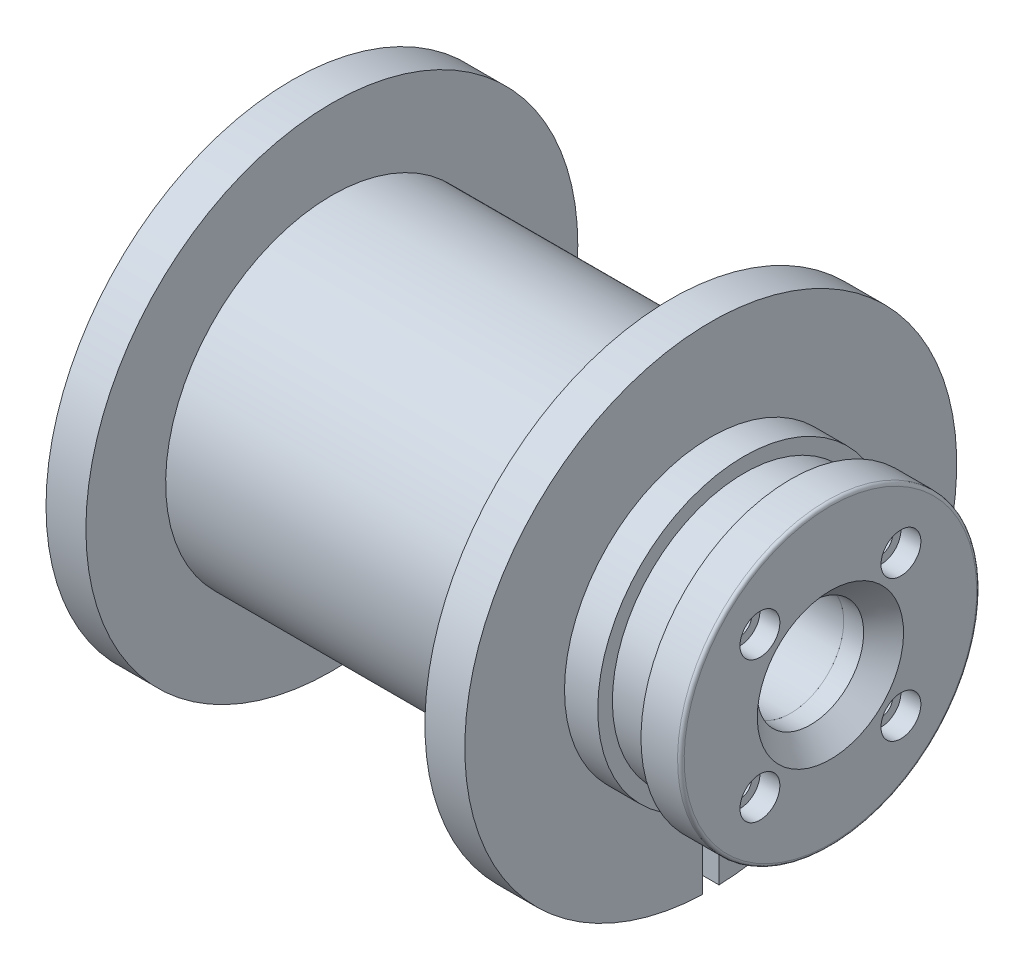
from build123d import *

# Parameters (mm, degrees)
SKETCH_5_W             = 6
SKETCH_5_H             = 6
CUT_EXTRUDE_3_DEPTH    = 35
CUT_EXTRUDE_2543_DEPTH = 69
SKETCH_11_R            = 1.1
CUT_EXTRUDE_8_DEPTH    = 20
SKETCH_12_R            = 22.5
SKETCH_12_R_2          = 8
SKETCH_12_R_3          = 1.75
EXTRUDE_1_DEPTH        = 3
SKETCH_13_R            = 22.5
SKETCH_13_R_2          = 3
SKETCH_13_R_3          = 8
EXTRUDE_2_DEPTH        = 3
FILLET_1_R             = 0.5
CHAMFER_1_SIZE         = 3
FILLET_2_R             = 0.5


# Read off the part's stored shape, not the designer's step: ピン穴
with BuildPart() as part:
    # ｽｹｯﾁ4 → 回転1 (revolve)
    with BuildSketch(Plane.XY, mode=Mode.PRIVATE) as revolve_1_sk:
        Polygon((-34, 11.2), (-34, 37), (-28, 37), (-28, 25), (23, 25), (23, 37), (29, 37), (29, 22), (34, 22), (34, 19.8), (41, 19.8), (41, 8), (11, 8), (11, 3.2), (1, 3.2), (1, 11.2), align=None)
    revolve(revolve_1_sk.sketch.rotate(Axis((-34, 0, 0), (1, 0, 0)), 180), axis=Axis((-34, 0, 0), (1, 0, 0)))

    # ｽｹｯﾁ5 → ｶｯﾄ - 押し出し3 (cut)
    with BuildSketch(Plane.ZY.offset(34)):
        with Locations((0, 10.5)):
            Rectangle(SKETCH_5_W, SKETCH_5_H)
    extrude(amount=-CUT_EXTRUDE_3_DEPTH, mode=Mode.SUBTRACT)

    # Cut-Extrude 2543 outline → Cut-Extrude 2543 (cut)
    with BuildSketch(Plane.ZY.offset(-41)):
        with BuildLine():
            ThreePointArc((-1.25, -36.978879107), (0, -37), (1.25, -36.978879107))
            Line((1.25, -36.978879107), (1.25, -22.422904116))
            ThreePointArc((1.25, -22.422904116), (0, -13.6), (-1.25, -22.422904116))
            Line((-1.25, -22.422904116), (-1.25, -36.978879107))
        make_face()
    extrude(amount=CUT_EXTRUDE_2543_DEPTH, mode=Mode.SUBTRACT)

    # ｽｹｯﾁ11 → ｶｯﾄ - 押し出し8 (cut)
    with BuildSketch(Plane(origin=(41, 0, 0), x_dir=(0, 0, -1), z_dir=(1, 0, 0))):
        with Locations(Location((-10.606601718, 10.606601718, 0), (0, 0, 90))):
            Circle(SKETCH_11_R)
        with Locations(Location((-10.606601718, -10.606601718, 0), (0, 0, 90))):
            Circle(SKETCH_11_R)
        with Locations(Location((10.606601718, 10.606601718, 0), (0, 0, 90))):
            Circle(SKETCH_11_R)
        with Locations(Location((10.606601718, -10.606601718, 0), (0, 0, 90))):
            Circle(SKETCH_11_R)
    extrude(amount=-CUT_EXTRUDE_8_DEPTH, mode=Mode.SUBTRACT)

    # ﾌｨﾚｯﾄ2
    fillet_2_edges = [part.edges().sort_by_distance(p)[0] for p in [
        (11, 8, 0),
    ]]
    fillet(fillet_2_edges, radius=FILLET_2_R)


with BuildPart() as body_2:
    # ｽｹｯﾁ12 → ﾎﾞｽ - 押し出し1 (new body)
    with BuildSketch(Plane(origin=(41, 0, 0), x_dir=(0, 0, -1), z_dir=(1, 0, 0))):
        with Locations(Location((0, 0, 0), (0, 0, 90))):
            Circle(SKETCH_12_R)
        with Locations(Location((0, 0, 0), (0, 0, 90))):
            Circle(SKETCH_12_R_2, mode=Mode.SUBTRACT)
        with Locations(Location((-10.606601718, 10.606601718, 0), (0, 0, 90))):
            Circle(SKETCH_12_R_3, mode=Mode.SUBTRACT)
        with Locations(Location((10.606601718, 10.606601718, 0), (0, 0, 90))):
            Circle(SKETCH_12_R_3, mode=Mode.SUBTRACT)
        with Locations(Location((10.606601718, -10.606601718, 0), (0, 0, 90))):
            Circle(SKETCH_12_R_3, mode=Mode.SUBTRACT)
        with Locations(Location((-10.606601718, -10.606601718, 0), (0, 0, 90))):
            Circle(SKETCH_12_R_3, mode=Mode.SUBTRACT)
    extrude(amount=EXTRUDE_1_DEPTH)

    # ｽｹｯﾁ13 → ﾎﾞｽ - 押し出し2 (add)
    with BuildSketch(Plane(origin=(44, 0, 0), x_dir=(0, 0, -1), z_dir=(1, 0, 0))):
        with Locations(Location((0, 0, 0), (0, 0, 90))):
            Circle(SKETCH_13_R)
        with Locations(Location((-10.606601718, 10.606601718, 0), (0, 0, 90))):
            Circle(SKETCH_13_R_2, mode=Mode.SUBTRACT)
        with Locations(Location((-10.606601718, -10.606601718, 0), (0, 0, 90))):
            Circle(SKETCH_13_R_2, mode=Mode.SUBTRACT)
        with Locations(Location((10.606601718, 10.606601718, 0), (0, 0, 90))):
            Circle(SKETCH_13_R_2, mode=Mode.SUBTRACT)
        with Locations(Location((10.606601718, -10.606601718, 0), (0, 0, 90))):
            Circle(SKETCH_13_R_2, mode=Mode.SUBTRACT)
        with Locations(Location((0, 0, 0), (0, 0, 90))):
            Circle(SKETCH_13_R_3, mode=Mode.SUBTRACT)
    extrude(amount=EXTRUDE_2_DEPTH)

    # ﾌｨﾚｯﾄ1
    fillet_1_edges = [body_2.edges().sort_by_distance(p)[0] for p in [
        (47, -22.5, 0),
    ]]
    fillet(fillet_1_edges, radius=FILLET_1_R)

    # 面取り1
    chamfer_1_edges = [body_2.edges().sort_by_distance(p)[0] for p in [
        (47, -8, 0),
    ]]
    chamfer(chamfer_1_edges, length=CHAMFER_1_SIZE)


solid = Compound([part.part, body_2.part])
